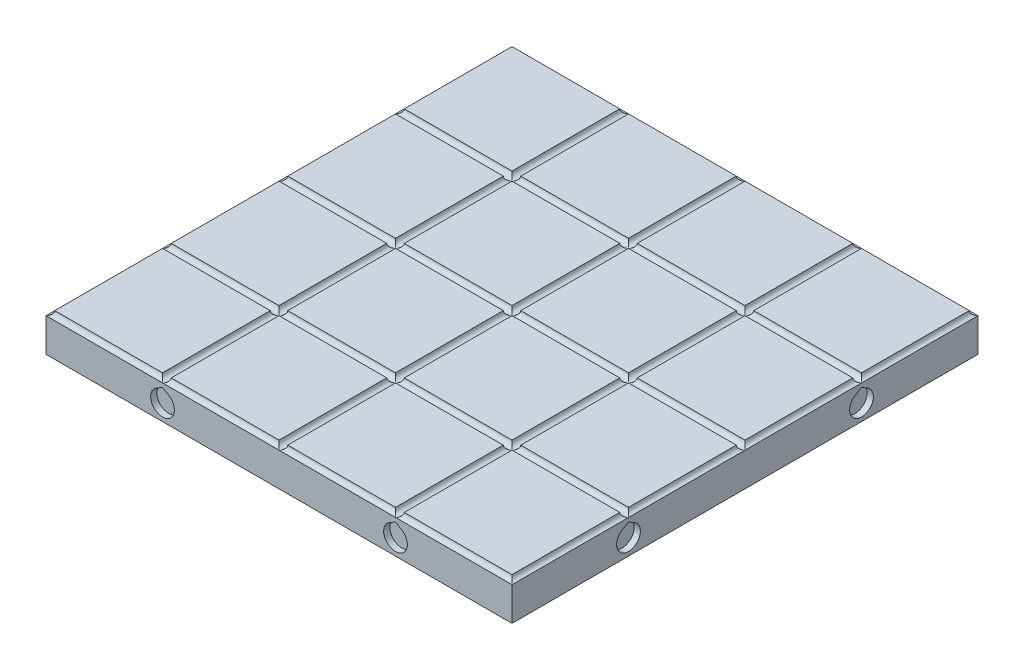
from build123d import *

# Parameters (mm, degrees)
SKETCH_1_W                  = 160
SKETCH_1_H                  = 160
EXTRUDE_1_DEPTH             = 13
SWEEP_1_PROFILE_R           = 1.5
PATTERN_LINEAR_1_COUNT      = 5
PATTERN_LINEAR_1_PITCH      = 40
SWEEP_2_PROFILE_R           = 1.5
PATTERN_LINEAR_2_COUNT      = 5
PATTERN_LINEAR_2_PITCH      = 40
PATTERN_LINEAR_2_COUNT_DIR2 = 5
PATTERN_LINEAR_2_PITCH_DIR2 = 40
SKETCH_181_R                = 4.075
CUT_EXTRUDE_1_DEPTH         = 2.15
PATTERN_CIRCULAR_1_COUNT    = 4
F_1_THE_OTHER_WAY_COUNT     = 4


with BuildPart() as part:
    # Эскиз1 → Бобышка-Вытянуть1 (new body)
    with BuildSketch(Plane(origin=(0, 0, 0), x_dir=(1, 0, 0), z_dir=(0, 1, 0))):
        Rectangle(SKETCH_1_W, SKETCH_1_H)
    extrude(amount=-EXTRUDE_1_DEPTH)

    # Вырез-По траектории1: sweep along a path in Эскиз2
    with BuildLine(Plane(origin=(0, 0, 0), x_dir=(1, 0, 0), z_dir=(0, 1, 0))) as sweep_1_path:
        Line((-80, 80), (-80, -80))
    # Вырез-По траектории1 profile (on start of the path) → Вырез-По траектории1 (sweep, cut)
    with BuildSketch(Plane(origin=(-80, 0, -80), x_dir=(1, 0, 0), z_dir=(0, 0, 1))):
        Circle(SWEEP_1_PROFILE_R)
    sweep_1 = sweep(path=sweep_1_path.line, mode=Mode.SUBTRACT)

    # Линейный массив1: Вырез-По траектории1 ×5
    with Locations(*[(i * PATTERN_LINEAR_1_PITCH, 0, 0) for i in range(1, PATTERN_LINEAR_1_COUNT)]):
        add(sweep_1, mode=Mode.SUBTRACT)

    # Вырез-По траектории2: sweep along a path in Эскиз180
    with BuildLine(Plane(origin=(0, 0, 0), x_dir=(1, 0, 0), z_dir=(0, 1, 0))) as sweep_2_path:
        Line((-80, -80), (80, -80))
    # Вырез-По траектории2 profile (on start of the path) → Вырез-По траектории2 (sweep, cut)
    with BuildSketch(Plane(origin=(-80, 0, 80), x_dir=(0, 0, 1), z_dir=(1, 0, 0))):
        Circle(SWEEP_2_PROFILE_R)
    sweep_2 = sweep(path=sweep_2_path.line, mode=Mode.SUBTRACT)

    # Линейный массив2: Sweep 2 5 × 5
    with Locations(*[(i * PATTERN_LINEAR_2_PITCH, 0, -j * PATTERN_LINEAR_2_PITCH_DIR2) for i in range(PATTERN_LINEAR_2_COUNT) for j in range(PATTERN_LINEAR_2_COUNT_DIR2) if (i, j) != (0, 0)]):
        add(sweep_2, mode=Mode.SUBTRACT)

    # Эскиз181 → Вырез-Вытянуть1 (cut)
    with BuildSketch(Plane.XY.offset(80)):
        with Locations((-40, -7.565202347)):
            Circle(SKETCH_181_R)
        with BuildLine():
            Line((-37.9625, -4.036148827), (-40, -2.859797653))
            Line((-40, -2.859797653), (-42.0375, -4.036148827))
            ThreePointArc((-42.0375, -4.036148827), (-40, -3.490202347), (-37.9625, -4.036148827))
        make_face()
        with Locations((40, -7.565202347)):
            Circle(SKETCH_181_R)
        with BuildLine():
            Line((42.0375, -4.036148827), (40, -2.859797653))
            Line((40, -2.859797653), (37.9625, -4.036148827))
            ThreePointArc((37.9625, -4.036148827), (40, -3.490202347), (42.0375, -4.036148827))
        make_face()
    cut_extrude_1 = extrude(amount=-CUT_EXTRUDE_1_DEPTH, mode=Mode.SUBTRACT)

    # Круговой массив1: Вырез-Вытянуть1 ×4 about axis
    pattern_circular_1_axis = Axis((0, -13, 0), (0, -1, 0))
    for i in range(1, PATTERN_CIRCULAR_1_COUNT):
        add(cut_extrude_1.rotate(pattern_circular_1_axis, i * 360 / PATTERN_CIRCULAR_1_COUNT), mode=Mode.SUBTRACT)

    # 1 the other way: Вырез-Вытянуть1 ×4 about axis
    f_1_the_other_way_axis = Axis((0, -13, 0), (0, 1, 0))
    for i in range(1, F_1_THE_OTHER_WAY_COUNT):
        add(cut_extrude_1.rotate(f_1_the_other_way_axis, i * 360 / F_1_THE_OTHER_WAY_COUNT), mode=Mode.SUBTRACT)


solid = part.part
